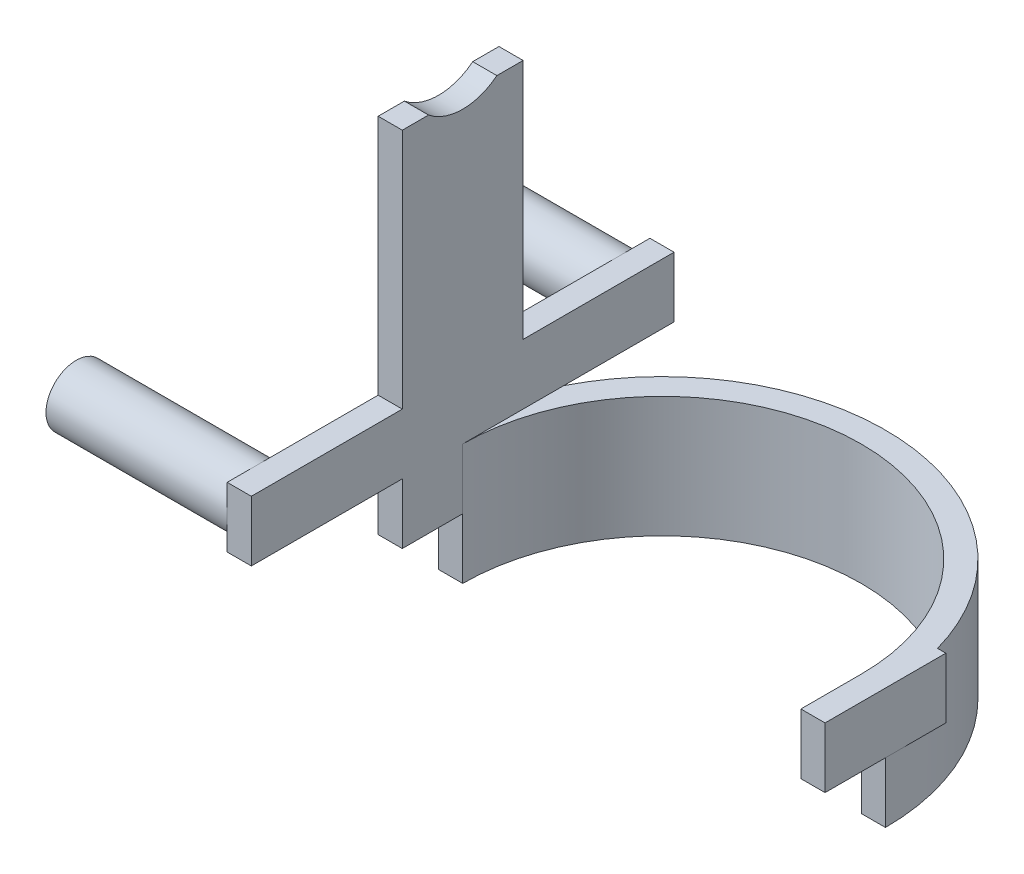
from build123d import *

# Parameters (mm, degrees)
EXTRUDE_1_DEPTH     = 40
SKETCH_2_W          = 8
SKETCH_2_H          = 40
EXTRUDE_2_DEPTH     = 100
SKETCH_3_R          = 18
CUT_EXTRUDE_1_DEPTH = 217.748702418
SKETCH_5_W          = 87.00766185
SKETCH_5_H          = 115.01495327
CUT_EXTRUDE_2_DEPTH = 10
SKETCH_6_R          = 85.063361003
CUT_EXTRUDE_3_DEPTH = 20
SKETCH_7_W          = 140
SKETCH_7_H          = 20
EXTRUDE_3_DEPTH     = 8
SKETCH_9_R          = 10
EXTRUDE_4_DEPTH     = 60


with BuildPart() as part:
    # 草图1 → 凸台-拉伸1 (new body)
    with BuildSketch(Plane(origin=(0, 0, 0), x_dir=(1, 0, 0), z_dir=(0, 1, 0))):
        with BuildLine():
            Line((-74, 20), (-71.246052522, 20))
            ThreePointArc((-71.246052522, 20), (0, 74), (71.246052522, 20))
            Line((71.246052522, 20), (74, 20))
            Line((74, 20), (74, -20))
            Line((74, -20), (66, -20))
            Line((66, -20), (66, 0))
            ThreePointArc((66, 0), (0, 66), (-66, 0))
            Line((-66, 0), (-66, -20))
            Line((-66, -20), (-74, -20))
            Line((-74, -20), (-74, 20))
        make_face()
    extrude(amount=EXTRUDE_1_DEPTH)

    # 草图2 → 凸台-拉伸2 (add)
    with BuildSketch(Plane(origin=(0, 40, 0), x_dir=(1, 0, 0), z_dir=(0, 1, 0))):
        with Locations((-70, 0)):
            Rectangle(SKETCH_2_W, SKETCH_2_H)
        with Locations((70, 0)):
            Rectangle(SKETCH_2_W, SKETCH_2_H)
    extrude(amount=EXTRUDE_2_DEPTH)

    # 草图3 → 切除-拉伸1 (cut, through all)
    with BuildSketch(Plane.ZY.offset(74)):
        with Locations((0, 154)):
            Circle(SKETCH_3_R)
    extrude(amount=-CUT_EXTRUDE_1_DEPTH, mode=Mode.SUBTRACT)

    # 草图5 → 切除-拉伸2 (cut)
    with BuildSketch(Plane(origin=(74, 0, 0), x_dir=(0, 0, -1), z_dir=(1, 0, 0))):
        with Locations((-23.503830925, 97.507476635)):
            Rectangle(SKETCH_5_W, SKETCH_5_H)
    extrude(amount=-CUT_EXTRUDE_2_DEPTH, mode=Mode.SUBTRACT)

    # 草图6 → 切除-拉伸3 (cut)
    with BuildSketch(Plane.XZ):
        Circle(SKETCH_6_R)
        with BuildLine():
            Line((-71.246052522, 20), (-66, 20))
            Line((-66, 20), (-66, 0))
            Line((-66, 0), (-74, 0))
            ThreePointArc((-74, 0), (0, -74), (74, 0))
            Line((74, 0), (66, 0))
            Line((66, 0), (66, 20))
            Line((66, 20), (71.246052522, 20))
            ThreePointArc((71.246052522, 20), (0, 74), (-71.246052522, 20))
        make_face(mode=Mode.SUBTRACT)
    extrude(amount=-CUT_EXTRUDE_3_DEPTH, mode=Mode.SUBTRACT)

    # 草图7 → 凸台-拉伸3 (add)
    with BuildSketch(Plane.ZY.offset(74)):
        with Locations((0, 50)):
            Rectangle(SKETCH_7_W, SKETCH_7_H)
    extrude(amount=-EXTRUDE_3_DEPTH)

    # 草图9 → 凸台-拉伸4 (add)
    with BuildSketch(Plane.ZY.offset(74)):
        with Locations((-60, 50)):
            Circle(SKETCH_9_R)
        with Locations((60, 50)):
            Circle(SKETCH_9_R)
    extrude(amount=EXTRUDE_4_DEPTH)


solid = part.part
